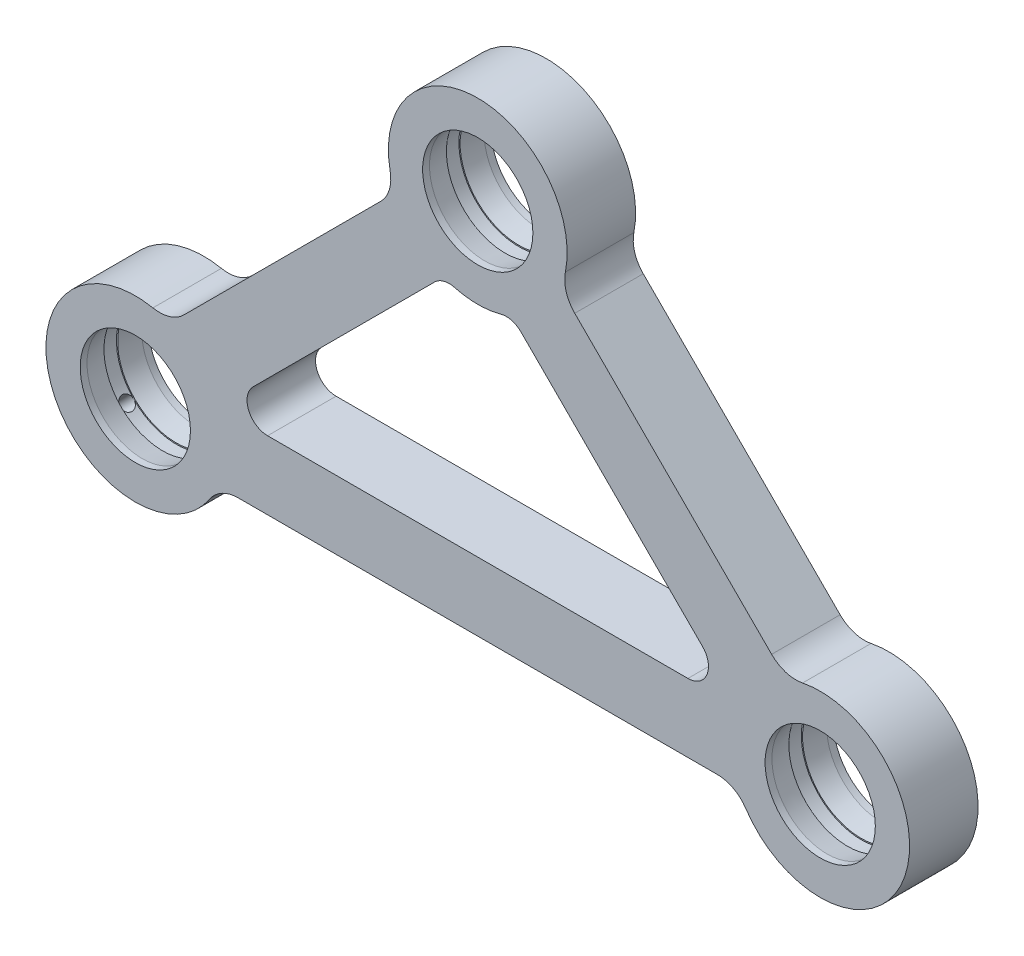
from build123d import *

# Parameters (mm, degrees)
SKETCH1_R               = 8.05
BOSS_EXTRUDE1_DEPTH     = 8
CUT_EXTRUDE1_DEPTH      = 1
CUT_EXTRUDE1_DEPTH_BACK = 1
SKETCH3_R               = 8.755307923
SKETCH4_R               = 1
CUT_EXTRUDE2_DEPTH      = 6
FILLET1_R               = 3
FILLET2_R               = 5
SKETCH5_R               = 1
CUT_EXTRUDE3_DEPTH      = 10
DRAFT4_ANGLE            = -10
DRAFT6_ANGLE            = -10
SKETCH6_R               = 1
CUT_EXTRUDE4_DEPTH      = 10
BOSS_EXTRUDE3_START     = 1
SKETCH7_R               = 8.05
BOSS_EXTRUDE3_DEPTH     = 1
SKETCH11_R              = 8.05
BOSS_EXTRUDE4_DEPTH     = 1


with BuildPart() as part:
    # Sketch1 → Boss-Extrude1 (new body)
    with BuildSketch(Plane.XY):
        with BuildLine():
            Line((11.402892275, 45.011963645), (-21.549967203, 12.059104167))
            ThreePointArc((-21.549967203, 12.059104167), (-38.594631457, -4.994018792), (-14.483854895, -5))
            Line((-14.483854895, -5), (61.407847779, -5))
            ThreePointArc((61.407847779, -5), (85.518624341, -4.994018792), (68.473960087, 12.059104167))
            Line((68.473960087, 12.059104167), (35.521100609, 45.011963645))
            ThreePointArc((35.521100609, 45.011963645), (23.461996442, 63.05), (11.402892275, 45.011963645))
        make_face()
        with BuildLine():
            Line((-14.466935746, 5), (18.473960087, 37.940895833))
            ThreePointArc((18.473960087, 37.940895833), (23.461996442, 36.95), (28.450032797, 37.940895833))
            Line((28.450032797, 37.940895833), (61.39092863, 5))
            Line((61.39092863, 5), (-14.466935746, 5))
        make_face(mode=Mode.SUBTRACT)
        with Locations((-26.538003558, 0)):
            Circle(SKETCH1_R, mode=Mode.SUBTRACT)
        with Locations((23.461996442, 50)):
            Circle(SKETCH1_R, mode=Mode.SUBTRACT)
        with Locations((73.461996442, 0)):
            Circle(SKETCH1_R, mode=Mode.SUBTRACT)
    extrude(amount=BOSS_EXTRUDE1_DEPTH)

    # Sketch3 → Cut-Extrude1 (cut, two sides: drawn at the far end of the back side and taken through both)
    with BuildSketch(Plane.XY.offset(4).offset(-CUT_EXTRUDE1_DEPTH_BACK)):
        with Locations((-26.538003558, 0)):
            Circle(SKETCH3_R)
        with Locations((23.461996442, 50)):
            Circle(SKETCH3_R)
        with Locations((73.461996442, 0)):
            Circle(SKETCH3_R)
    extrude(amount=CUT_EXTRUDE1_DEPTH + CUT_EXTRUDE1_DEPTH_BACK, mode=Mode.SUBTRACT)

    # Sketch4 → Cut-Extrude2 (cut)
    with BuildSketch(Plane(origin=(0, 62.95, 0), x_dir=(-1, 0, 0), z_dir=(0, -1, 0))):
        with Locations((-23.511996442, -4)):
            Circle(SKETCH4_R)
    extrude(amount=CUT_EXTRUDE2_DEPTH, mode=Mode.SUBTRACT)

    # Fillet1
    fillet1_edges = [part.edges().sort_by_distance(p)[0] for p in [
        (-14.466935746, 5, 4),
        (18.473960087, 37.940895833, 4),
        (28.450032797, 37.940895833, 4),
        (61.39092863, 5, 4),
    ]]
    fillet(fillet1_edges, radius=FILLET1_R)

    # Fillet2
    fillet2_edges = [part.edges().sort_by_distance(p)[0] for p in [
        (68.473960087, 12.059104167, 4),
        (35.521100609, 45.011963645, 4),
        (11.402892275, 45.011963645, 4),
        (-21.549967203, 12.059104167, 4),
        (-14.483854895, -5, 4),
        (61.407847779, -5, 4),
    ]]
    fillet(fillet2_edges, radius=FILLET2_R)

    # Sketch5 → Cut-Extrude3 (cut)
    with BuildSketch(Plane(origin=(45.888031037, -45.888031037, 0), x_dir=(0, 0, 1), z_dir=(-0.7071067811865489, 0.7071067811865462, 0))):
        with Locations((4, 51.895475844)):
            Circle(SKETCH5_R)
    extrude(amount=CUT_EXTRUDE3_DEPTH, mode=Mode.SUBTRACT)

    # Draft4
    draft4_faces = [part.faces().sort_by_distance(p)[0] for p in [
        (-34.588003558, 0, 6.5),
        (15.411996442, 50, 6.5),
        (65.411996442, 0, 6.5),
    ]]
    draft(draft4_faces, Plane.XY.offset(8), DRAFT4_ANGLE)

    # Draft6
    draft6_faces = [part.faces().sort_by_distance(p)[0] for p in [
        (-34.588003558, 0, 1.5),
        (65.411996442, 0, 1.5),
        (15.411996442, 50, 1.5),
    ]]
    draft(draft6_faces, Plane(origin=(0, 0, 0), x_dir=(-1, 0, 0), z_dir=(0, 0, -1)), DRAFT6_ANGLE)

    # Sketch6 → Cut-Extrude4 (cut)
    with BuildSketch(Plane(origin=(-22.426034595, -22.426034595, 0), x_dir=(0, 0, -1), z_dir=(0.7071067811865486, 0.7071067811865465, 0))):
        with Locations((-4, 18.815202275)):
            Circle(SKETCH6_R)
    extrude(amount=CUT_EXTRUDE4_DEPTH, mode=Mode.SUBTRACT)

    # Sketch7 → Boss-Extrude3 (add)
    with BuildSketch(Plane.XY.offset(8).offset(BOSS_EXTRUDE3_START)):
        with BuildLine():
            Line((66.37203036, 14.161033894), (37.623030336, 42.910033918))
            ThreePointArc((37.623030336, 42.910033918), (36.372509491, 44.998612426), (36.256467899, 47.430175075))
            ThreePointArc((36.256467899, 47.430175075), (23.461996442, 63.05), (10.667524985, 47.430175075))
            ThreePointArc((10.667524985, 47.430175075), (10.551483393, 44.998612426), (9.300962548, 42.910033918))
            Line((9.300962548, 42.910033918), (-19.448037476, 14.161033894))
            ThreePointArc((-19.448037476, 14.161033894), (-21.536615984, 12.910513049), (-23.968178633, 12.794471457))
            ThreePointArc((-23.968178633, 12.794471457), (-38.594631457, -4.994018792), (-15.673805398, -7.229916898))
            ThreePointArc((-15.673805398, -7.229916898), (-13.872377163, -5.592596257), (-11.511277368, -5))
            Line((-11.511277368, -5), (58.435270252, -5))
            ThreePointArc((58.435270252, -5), (60.796370047, -5.592596257), (62.597798282, -7.229916898))
            ThreePointArc((62.597798282, -7.229916898), (85.518624341, -4.994018792), (70.892171517, 12.794471457))
            ThreePointArc((70.892171517, 12.794471457), (68.460608868, 12.910513049), (66.37203036, 14.161033894))
        make_face()
        with Locations((-26.538003558, 0)):
            Circle(SKETCH7_R, mode=Mode.SUBTRACT)
        with Locations((73.461996442, 0)):
            Circle(SKETCH7_R, mode=Mode.SUBTRACT)
        with Locations((23.461996442, 50)):
            Circle(SKETCH7_R, mode=Mode.SUBTRACT)
        with BuildLine():
            Line((-7.224295059, 5), (54.148287943, 5))
            ThreePointArc((54.148287943, 5), (56.919926541, 6.851949703), (56.269608287, 10.121320344))
            Line((56.269608287, 10.121320344), (29.765225162, 36.625703469))
            ThreePointArc((29.765225162, 36.625703469), (28.41775702, 37.402857339), (26.862239701, 37.400760111))
            ThreePointArc((26.862239701, 37.400760111), (23.461996442, 36.95), (20.061753183, 37.400760111))
            ThreePointArc((20.061753183, 37.400760111), (18.506235864, 37.402857339), (17.158767722, 36.625703469))
            Line((17.158767722, 36.625703469), (-9.345615403, 10.121320344))
            ThreePointArc((-9.345615403, 10.121320344), (-9.995933657, 6.851949703), (-7.224295059, 5))
        make_face(mode=Mode.SUBTRACT)
    extrude(amount=-BOSS_EXTRUDE3_DEPTH)

    # Sketch11 → Boss-Extrude4 (add)
    with BuildSketch(Plane(origin=(0, 0, 0), x_dir=(-1, 0, 0), z_dir=(0, 0, -1))):
        with BuildLine():
            Line((-37.623030336, 42.910033918), (-66.37203036, 14.161033894))
            ThreePointArc((-66.37203036, 14.161033894), (-68.460608868, 12.910513049), (-70.892171517, 12.794471457))
            ThreePointArc((-70.892171517, 12.794471457), (-85.518624341, -4.994018792), (-62.597798282, -7.229916898))
            ThreePointArc((-62.597798282, -7.229916898), (-60.796370047, -5.592596257), (-58.435270252, -5))
            Line((-58.435270252, -5), (11.511277368, -5))
            ThreePointArc((11.511277368, -5), (13.872377163, -5.592596257), (15.673805398, -7.229916898))
            ThreePointArc((15.673805398, -7.229916898), (38.594631457, -4.994018792), (23.968178633, 12.794471457))
            ThreePointArc((23.968178633, 12.794471457), (21.536615984, 12.910513049), (19.448037476, 14.161033894))
            Line((19.448037476, 14.161033894), (-9.300962548, 42.910033918))
            ThreePointArc((-9.300962548, 42.910033918), (-10.551483393, 44.998612426), (-10.667524985, 47.430175075))
            ThreePointArc((-10.667524985, 47.430175075), (-23.461996442, 63.05), (-36.256467899, 47.430175075))
            ThreePointArc((-36.256467899, 47.430175075), (-36.372509491, 44.998612426), (-37.623030336, 42.910033918))
        make_face()
        with Locations((-73.461996442, 0)):
            Circle(SKETCH11_R, mode=Mode.SUBTRACT)
        with Locations((-23.461996442, 50)):
            Circle(SKETCH11_R, mode=Mode.SUBTRACT)
        with Locations((26.538003558, 0)):
            Circle(SKETCH11_R, mode=Mode.SUBTRACT)
        with BuildLine():
            Line((-17.158767722, 36.625703469), (9.345615403, 10.121320344))
            ThreePointArc((9.345615403, 10.121320344), (9.995933657, 6.851949703), (7.224295059, 5))
            Line((7.224295059, 5), (-54.148287943, 5))
            ThreePointArc((-54.148287943, 5), (-56.919926541, 6.851949703), (-56.269608287, 10.121320344))
            Line((-56.269608287, 10.121320344), (-29.765225162, 36.625703469))
            ThreePointArc((-29.765225162, 36.625703469), (-28.41775702, 37.402857339), (-26.862239701, 37.400760111))
            ThreePointArc((-26.862239701, 37.400760111), (-23.461996442, 36.95), (-20.061753183, 37.400760111))
            ThreePointArc((-20.061753183, 37.400760111), (-18.506235864, 37.402857339), (-17.158767722, 36.625703469))
        make_face(mode=Mode.SUBTRACT)
    extrude(amount=BOSS_EXTRUDE4_DEPTH)


solid = part.part
